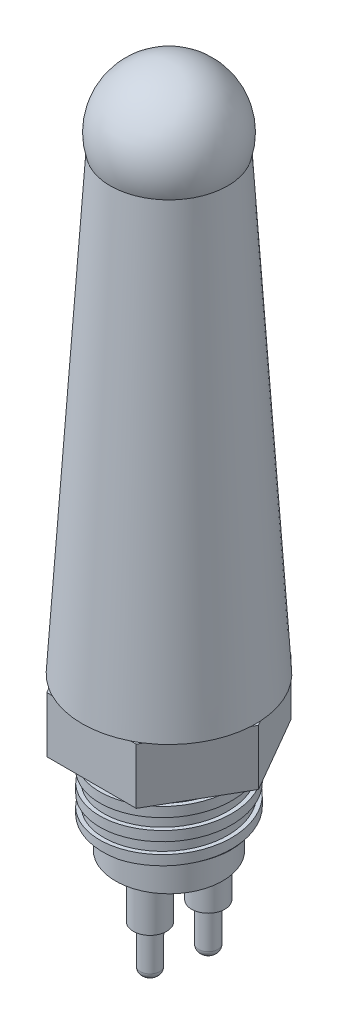
from build123d import *

# Parameters (mm, degrees)
BOSS_EXTRUDE1_DEPTH = 8
SKETCH3_R           = 9.5
BOSS_EXTRUDE2_DEPTH = 9.5
CUT_SWEEP1_PITCH    = 3
SKETCH14_R          = 7.7
BOSS_EXTRUDE3_DEPTH = 4.5
SKETCH15_R          = 2.4
BOSS_EXTRUDE4_DEPTH = 6
SKETCH16_R          = 1.4
BOSS_EXTRUDE5_DEPTH = 6.5
FILLET1_R           = 1


with BuildPart() as part:
    # Sketch1 → Revolve1 (revolve)
    with BuildSketch(Plane.XY):
        with BuildLine():
            Line((-8.453454689, 68.504923699), (-12.5, 3.504923699))
            Line((-12.5, 3.504923699), (0, 3.504923699))
            Line((0, 3.504923699), (0, 79.750144306))
            ThreePointArc((0, 79.750144306), (-7.034128992, 76.237963264), (-8.453454689, 68.504923699))
        make_face()
    revolve(axis=Axis((0, 0, 0), (0, 1, 0)))

    # Sketch2 → Boss-Extrude1 (add)
    with BuildSketch(Plane.XZ.offset(-3.504923699)):
        Polygon((12.874911003, 0), (6.437455501, 11.15), (-6.437455501, 11.15), (-12.874911003, 0), (-6.437455501, -11.15), (6.437455501, -11.15), align=None)
    extrude(amount=BOSS_EXTRUDE1_DEPTH)

    # Sketch3 → Boss-Extrude2 (add)
    with BuildSketch(Plane.XZ.offset(4.495076301)):
        with Locations(Location((0, 0, 0), (0, 0, 270))):
            Circle(SKETCH3_R)
    extrude(amount=BOSS_EXTRUDE2_DEPTH)

    # Cut-Sweep1: arcs per turn and ends read off the stored shape
    # Cut-Sweep1: the profile of 3DSketch1 profile screwed along a right-hand helix through 5 turns, 10 arcs to a turn; built about Z, then put on its axis
    cut_sweep1_z = Axis((0, 0, 0), (0, 0, 1))
    cut_sweep1_corners = [(9.5003, 0, -3.196719974), (8.922689725, 0, -3.196719974), (8.922689725, 0, -1.596719974), (9.5003, 0, -1.596719974)]
    with BuildLine(mode=Mode.PRIVATE) as cut_sweep1_profile:
        Line(cut_sweep1_corners[0], cut_sweep1_corners[1])
        Line(cut_sweep1_corners[1], cut_sweep1_corners[2])
        Line(cut_sweep1_corners[2], cut_sweep1_corners[3])
        Line(cut_sweep1_corners[3], cut_sweep1_corners[0])
    cut_sweep1_cap = Face(cut_sweep1_profile.wire())
    cut_sweep1_turn_angles = [0, 18, 36, 54, 72, 90, 108, 126, 144, 162, 180, 198, 216, 234, 252, 270, 288, 306, 324, 342, 360]
    cut_sweep1_turn_weights = [1, 0.9510565162951535, 1, 0.9510565162951535, 1, 0.9510565162951535, 1, 0.9510565162951535, 1, 0.9510565162951535, 1, 0.9510565162951535, 1, 0.9510565162951535, 1, 0.9510565162951535, 1, 0.9510565162951535, 1, 0.9510565162951535, 1]
    cut_sweep1_turn_rails = [Edge.make_bspline([Vector(p[0], p[1], 0).rotate(cut_sweep1_z, cut_sweep1_turn_angles[k]) / cut_sweep1_turn_weights[k] + Vector(0, 0, p[2] + CUT_SWEEP1_PITCH * cut_sweep1_turn_angles[k] / 360) for k in range(21)], [0, 0, 0, 1, 1, 2, 2, 3, 3, 4, 4, 5, 5, 6, 6, 7, 7, 8, 8, 9, 9, 10, 10, 10], 2, cut_sweep1_turn_weights) for p in cut_sweep1_corners]
    cut_sweep1_turn_sides = [Face.make_surface_from_curves(cut_sweep1_turn_rails[p[0]], cut_sweep1_turn_rails[p[1]]) for p in [(0, 1), (1, 2), (2, 3), (3, 0)]]
    cut_sweep1 = Plane(origin=(0, -13.995076301, 0), x_dir=(0, 0, -1), z_dir=(0, 1, 0)) * Solid(Shell([*[p.moved(Location((0, 0, CUT_SWEEP1_PITCH * i))) for i in range(5) for p in cut_sweep1_turn_sides], cut_sweep1_cap, cut_sweep1_cap.rotate(cut_sweep1_z, 1800).moved(Location((0, 0, CUT_SWEEP1_PITCH * 1800 / 360)))]))
    add(cut_sweep1, mode=Mode.SUBTRACT)

    # Sketch14 → Boss-Extrude3 (add)
    with BuildSketch(Plane.XZ.offset(13.995076301)):
        with Locations(Location((0, 0, 0), (0, 0, 270))):
            Circle(SKETCH14_R)
    extrude(amount=BOSS_EXTRUDE3_DEPTH)

    # Sketch15 → Boss-Extrude4 (add)
    with BuildSketch(Plane.XZ.offset(18.495076301)):
        with Locations(Location((1.558083021, 4.292165602, 0), (0, 0, 270))):
            Circle(SKETCH15_R)
        with Locations(Location((2.989300305, -2.657834398, 0), (0, 0, 270))):
            Circle(SKETCH15_R)
        with Locations(Location((-3.944680386, -2.186228866, 0), (0, 0, 270))):
            Circle(SKETCH15_R)
    extrude(amount=BOSS_EXTRUDE4_DEPTH)

    # Sketch16 → Boss-Extrude5 (add)
    with BuildSketch(Plane.XZ.offset(24.495076301)):
        with Locations(Location((-3.944680386, -2.186228866, 0), (0, 0, 90))):
            Circle(SKETCH16_R)
        with Locations(Location((2.989300305, -2.657834398, 0), (0, 0, 90))):
            Circle(SKETCH16_R)
        with Locations(Location((1.558083021, 4.292165602, 0), (0, 0, 90))):
            Circle(SKETCH16_R)
    extrude(amount=BOSS_EXTRUDE5_DEPTH)

    # Fillet1
    fillet1_edges = [part.edges().sort_by_distance(p)[0] for p in [
        (-3.944680386, -30.995076301, -3.586228866),
        (2.989300305, -30.995076301, -4.057834398),
        (1.558083021, -30.995076301, 2.892165602),
    ]]
    fillet(fillet1_edges, radius=FILLET1_R)


solid = part.part
